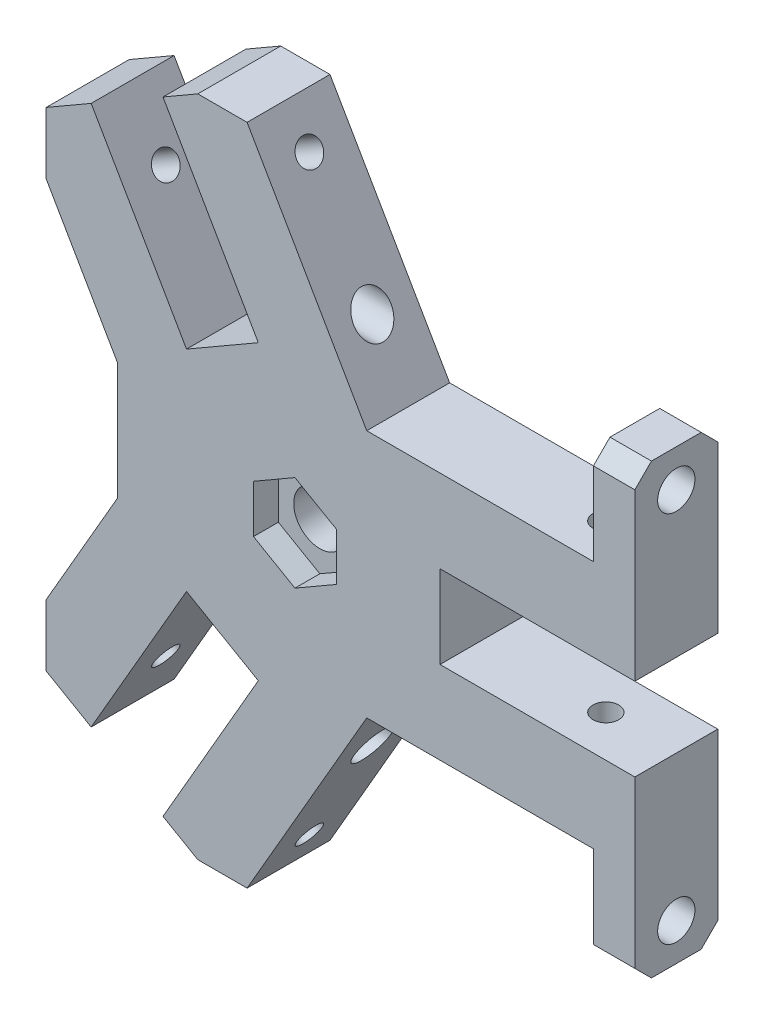
from build123d import *

# Parameters (mm, degrees)
SKETCH1_W                = 71
SKETCH1_H                = 80
BOSS_EXTRUDE1_DEPTH      = 10
SKETCH3_W                = 10
SKETCH3_H                = 10
CUT_EXTRUDE1_DEPTH       = 10
SKETCH5_W                = 28.158683969
SKETCH5_H                = 10
CUT_EXTRUDE3_DEPTH       = 10
CIRPATTERN1_COUNT        = 3
M6_CLEARANCE_HOLE1_D     = 6.3
CUT_EXTRUDE6_DEPTH       = 3
SKETCH11_R               = 1.55
CUT_EXTRUDE7_DEPTH       = 108.429046352
CIRPATTERN2_COUNT        = 3
CUT_EXTRUDE8_DEPTH       = 10
CUT_EXTRUDE9_DEPTH       = 10
CUT_EXTRUDE10_DEPTH      = 10
SKETCH15_W               = 111
SKETCH15_H               = 42
BOSS_EXTRUDE2_DEPTH      = 10
SKETCH22_W               = 15
SKETCH22_H               = 54
BOSS_EXTRUDE3_DEPTH      = 10
M4_CLEARANCE_HOLE1_D     = 4.5
M4_CLEARANCE_HOLE1_DEPTH = 30
M4_CLEARANCE_HOLE1_TIP   = 1.351936393
SKETCH26_W               = 47.7
SKETCH26_H               = 6
CUT_EXTRUDE13_DEPTH      = 10
CHAMFER1_SIZE            = 4
CHAMFER1_SIZE_2          = 6.92820323
SKETCH27_W               = 6.3
SKETCH27_H               = 6
CUT_EXTRUDE14_DEPTH      = 10
CHAMFER2_SIZE            = 6.92820323
CHAMFER2_SIZE_2          = 4
CUT_EXTRUDE15_DEPTH      = 10
CUT_EXTRUDE16_DEPTH      = 2.2
CUT_EXTRUDE17_DEPTH      = 10
M4_CLEARANCE_HOLE2_D     = 4.5
SKETCH33_W               = 30
SKETCH33_H               = 90
CUT_EXTRUDE18_DEPTH      = 138.189649755
SKETCH34_W               = 10
SKETCH34_H               = 22
BOSS_EXTRUDE4_DEPTH      = 5
SKETCH38_R               = 2.25
CUT_EXTRUDE20_DEPTH      = 41
CHAMFER3_SIZE            = 2


with BuildPart() as part:
    # Sketch1 → Boss-Extrude1 (new body)
    with BuildSketch(Plane.XY):
        with Locations((35.5, 40)):
            Rectangle(SKETCH1_W, SKETCH1_H)
    extrude(amount=BOSS_EXTRUDE1_DEPTH)

    # Sketch3 → Cut-Extrude1 (cut)
    with BuildSketch(Plane.XY.offset(10)):
        Polygon((25.580127019, 57.655444566), (16.919872981, 52.655444566), (11.919872981, 61.315698604), (20.580127019, 66.315698604), align=None)
        Polygon((11.919872981, 18.684301396), (20.580127019, 13.684301396), (25.580127019, 22.344555434), (16.919872981, 27.344555434), align=None)
        with Locations((52.5, 40)):
            Rectangle(SKETCH3_W, SKETCH3_H)
    extrude(amount=-CUT_EXTRUDE1_DEPTH, mode=Mode.SUBTRACT)

    # Sketch5 → Cut-Extrude3 (cut)
    with BuildSketch(Plane.XY.offset(10)):
        with Locations((71.579341985, 40)):
            Rectangle(SKETCH5_W, SKETCH5_H)
    cut_extrude3 = extrude(amount=-CUT_EXTRUDE3_DEPTH, mode=Mode.SUBTRACT)

    # CirPattern1: Cut-Extrude3 ×3 about axis
    cirpattern1_axis = Axis((30, 40, 10), (0, 0, -1))
    for i in range(1, CIRPATTERN1_COUNT):
        add(cut_extrude3.rotate(cirpattern1_axis, i * 360 / CIRPATTERN1_COUNT), mode=Mode.SUBTRACT)

    # M6 Clearance Hole1 (through all)
    with Locations(Plane.XY.offset(10)):
        with Locations((30, 40)):
            Hole(M6_CLEARANCE_HOLE1_D / 2)

    # Sketch10 → Cut-Extrude6 (cut)
    with BuildSketch(Plane.XY.offset(10)):
        Polygon((30, 45.773502692), (25, 42.886751346), (25, 37.113248654), (30, 34.226497308), (35, 37.113248654), (35, 42.886751346), align=None)
    extrude(amount=-CUT_EXTRUDE6_DEPTH, mode=Mode.SUBTRACT)

    # Sketch11 → Cut-Extrude7 (cut, through all)
    with BuildSketch(Plane.XZ):
        with Locations(Location((62.5, 5, 0), (0, 0, 270))):
            Circle(SKETCH11_R)
    cut_extrude7 = extrude(amount=-CUT_EXTRUDE7_DEPTH, mode=Mode.SUBTRACT)

    # CirPattern2: Cut-Extrude7 ×3 about axis
    cirpattern2_axis = Axis((30, 40, 7), (0, 0, 1))
    for i in range(1, CIRPATTERN2_COUNT):
        add(cut_extrude7.rotate(cirpattern2_axis, i * 360 / CIRPATTERN2_COUNT), mode=Mode.SUBTRACT)

    # Sketch12 → Cut-Extrude8 (cut)
    with BuildSketch(Plane.XY.offset(10)):
        Polygon((71, 0), (71, 25), (38.660254038, 25), (24.226497308, 0), align=None)
    cut_extrude8 = extrude(amount=-CUT_EXTRUDE8_DEPTH, mode=Mode.SUBTRACT)

    # Mirror1: Cut-Extrude8 across plane
    add(cut_extrude8.mirror(Plane(origin=(0, 40, 0), x_dir=(0, 0, 1), z_dir=(0, -1, 0))), mode=Mode.SUBTRACT)

    # Sketch13 → Cut-Extrude9 (cut)
    with BuildSketch(Plane.XY.offset(10)):
        Polygon((0, 61.961524227), (8.624364028, 47.023687548), (8.624364028, 32.976312452), (0, 18.038475773), align=None)
    extrude(amount=-CUT_EXTRUDE9_DEPTH, mode=Mode.SUBTRACT)

    # Sketch14 → Cut-Extrude10 (cut)
    with BuildSketch(Plane.XY.offset(10)):
        Polygon((-3.240381057, 12.425971147), (22.740381057, -2.574028853), (18.169872981, -10.490381057), (-7.810889132, 4.509618943), align=None)
    cut_extrude10 = extrude(amount=-CUT_EXTRUDE10_DEPTH, mode=Mode.SUBTRACT)

    # Mirror2: Cut-Extrude10 across plane
    add(cut_extrude10.mirror(Plane(origin=(0, 40, 0), x_dir=(0, 0, 1), z_dir=(0, -1, 0))), mode=Mode.SUBTRACT)

    # Sketch15 → Boss-Extrude2 (add)
    with BuildSketch(Plane.XY.offset(10)):
        with Locations((126.5, 40)):
            Rectangle(SKETCH15_W, SKETCH15_H)
    extrude(amount=-BOSS_EXTRUDE2_DEPTH)

    # Sketch22 → Boss-Extrude3 (add)
    with BuildSketch(Plane.XY.offset(10)):
        with Locations((174.5, 40)):
            Rectangle(SKETCH22_W, SKETCH22_H)
    extrude(amount=-BOSS_EXTRUDE3_DEPTH)

    # M4 Clearance Hole1
    with Locations(Plane(origin=(182, 0, 0), x_dir=(0, 0, -1), z_dir=(1, 0, 0))):
        with Locations((-5, 62.5), (-5, 17.5)):
            Hole(M4_CLEARANCE_HOLE1_D / 2, depth=M4_CLEARANCE_HOLE1_DEPTH)
            with Locations((0, 0, -(M4_CLEARANCE_HOLE1_DEPTH + M4_CLEARANCE_HOLE1_TIP / 2))):  # 118° drill point
                Cone(0, M4_CLEARANCE_HOLE1_D / 2, M4_CLEARANCE_HOLE1_TIP, mode=Mode.SUBTRACT)

    # Sketch26 → Cut-Extrude13 (cut)
    with BuildSketch(Plane.XY.offset(10)):
        with Locations((143.15, 58)):
            Rectangle(SKETCH26_W, SKETCH26_H)
    cut_extrude13 = extrude(amount=-CUT_EXTRUDE13_DEPTH, mode=Mode.SUBTRACT)

    # Mirror3: Cut-Extrude13 across plane
    add(cut_extrude13.mirror(Plane(origin=(0, 40, 0), x_dir=(0, 0, 1), z_dir=(0, -1, 0))), mode=Mode.SUBTRACT)

    # Chamfer1
    # the kernel refuses this chamfer: 6.92820323, 4 mm, written as the material it adds along each edge
    with BuildSketch(Plane(origin=(119.3, 25, 10), x_dir=(0.9983227437537926, 0.05789386240267157, 0), z_dir=(0, 0, -1))) as chamfer1_piece_1_section:
        Polygon((CHAMFER1_SIZE * 0.998322743754, CHAMFER1_SIZE * 0.0578938624027), (-CHAMFER1_SIZE_2 * 0.057893862405, CHAMFER1_SIZE_2 * 0.998322743793), (0, 0), align=None)
    chamfer1_piece_1 = extrude(amount=10, mode=Mode.PRIVATE)
    chamfer1_piece_1 = split(chamfer1_piece_1, bisect_by=Plane(origin=(120.625811149, 19, 5), z_dir=(0, 1, 0)), keep=Keep.TOP, mode=Mode.PRIVATE)
    add(chamfer1_piece_1)
    with BuildSketch(Plane(origin=(119.3, 55, 10), x_dir=(-0.019326765612697788, 0.999813220622208, 0), z_dir=(0, 0, -1))) as chamfer1_piece_2_section:
        Polygon((CHAMFER1_SIZE_2 * 0.999813220662, CHAMFER1_SIZE_2 * 0.0193267656135), (-CHAMFER1_SIZE * 0.0193267656127, CHAMFER1_SIZE * 0.999813220622), (0, 0), align=None)
    chamfer1_piece_2 = extrude(amount=10, mode=Mode.PRIVATE)
    chamfer1_piece_2 = split(chamfer1_piece_2, bisect_by=Plane(origin=(120.625811149, 61, 5), z_dir=(0, -1, 0)), keep=Keep.TOP, mode=Mode.PRIVATE)
    add(chamfer1_piece_2)

    # Sketch27 → Cut-Extrude14 (cut)
    with BuildSketch(Plane.XY.offset(10)):
        with Locations((74.15, 58)):
            Rectangle(SKETCH27_W, SKETCH27_H)
    cut_extrude14 = extrude(amount=-CUT_EXTRUDE14_DEPTH, mode=Mode.SUBTRACT)

    # Mirror4: Cut-Extrude14 across plane
    add(cut_extrude14.mirror(Plane(origin=(0, 40, 0), x_dir=(0, 0, 1), z_dir=(0, -1, 0))), mode=Mode.SUBTRACT)

    # Chamfer2
    # the kernel refuses this chamfer: 6.92820323, 4 mm, written as the material it adds along each edge
    with BuildSketch(Plane(origin=(77.3, 55, 10), x_dir=(0.019326765612699692, 0.9998132206222079, 0), z_dir=(0, 0, -1))) as chamfer2_piece_1_section:
        Polygon((CHAMFER2_SIZE * 0.999813220662, -CHAMFER2_SIZE * 0.0193267656135), (-CHAMFER2_SIZE_2 * 0.0193267656127, -CHAMFER2_SIZE_2 * 0.999813220622), (0, 0), align=None)
    chamfer2_piece_1 = extrude(amount=10, mode=Mode.PRIVATE)
    chamfer2_piece_1 = split(chamfer2_piece_1, bisect_by=Plane(origin=(75.974188851, 61, 5), z_dir=(0, -1, 0)), keep=Keep.TOP, mode=Mode.PRIVATE)
    add(chamfer2_piece_1)
    with BuildSketch(Plane(origin=(77.3, 25, 10), x_dir=(-0.9983227437537929, 0.05789386240266474, 0), z_dir=(0, 0, -1))) as chamfer2_piece_2_section:
        Polygon((CHAMFER2_SIZE_2 * 0.998322743754, -CHAMFER2_SIZE_2 * 0.0578938624027), (-CHAMFER2_SIZE * 0.057893862405, -CHAMFER2_SIZE * 0.998322743793), (0, 0), align=None)
    chamfer2_piece_2 = extrude(amount=10, mode=Mode.PRIVATE)
    chamfer2_piece_2 = split(chamfer2_piece_2, bisect_by=Plane(origin=(75.974188851, 19, 5), z_dir=(0, 1, 0)), keep=Keep.TOP, mode=Mode.PRIVATE)
    add(chamfer2_piece_2)

    # Sketch21 → Cut-Extrude15 (cut)
    with BuildSketch(Plane.XY.offset(10)):
        with BuildLine():
            Line((97.55, 47.5), (99.05, 47.5))
            ThreePointArc((99.05, 47.5), (106.55, 40), (99.05, 32.5))
            Line((99.05, 32.5), (97.55, 32.5))
            ThreePointArc((97.55, 32.5), (90.05, 40), (97.55, 47.5))
        make_face()
    extrude(amount=-CUT_EXTRUDE15_DEPTH, mode=Mode.SUBTRACT)

    # Sketch28 → Cut-Extrude16 (cut)
    with BuildSketch(Plane.XY.offset(10)):
        with BuildLine():
            Line((97.55, 51.25), (99.05, 51.25))
            ThreePointArc((99.05, 51.25), (110.3, 40), (99.05, 28.75))
            Line((99.05, 28.75), (97.55, 28.75))
            ThreePointArc((97.55, 28.75), (86.3, 40), (97.55, 51.25))
        make_face()
    extrude(amount=-CUT_EXTRUDE16_DEPTH, mode=Mode.SUBTRACT)

    # Sketch29 → Cut-Extrude17 (cut)
    with BuildSketch(Plane.XY.offset(10)):
        with BuildLine():
            Line((82.05, 57.2), (83.55, 57.2))
            ThreePointArc((83.55, 57.2), (85.25, 55.5), (83.55, 53.8))
            Line((83.55, 53.8), (82.05, 53.8))
            ThreePointArc((82.05, 53.8), (80.35, 55.5), (82.05, 57.2))
        make_face()
        with BuildLine():
            Line((113.05, 53.8), (114.55, 53.8))
            ThreePointArc((114.55, 53.8), (116.25, 55.5), (114.55, 57.2))
            Line((114.55, 57.2), (113.05, 57.2))
            ThreePointArc((113.05, 57.2), (111.35, 55.5), (113.05, 53.8))
        make_face()
        with BuildLine():
            Line((113.05, 22.8), (114.55, 22.8))
            ThreePointArc((114.55, 22.8), (116.25, 24.5), (114.55, 26.2))
            Line((114.55, 26.2), (113.05, 26.2))
            ThreePointArc((113.05, 26.2), (111.35, 24.5), (113.05, 22.8))
        make_face()
        with BuildLine():
            Line((82.05, 22.8), (83.55, 22.8))
            ThreePointArc((83.55, 22.8), (85.25, 24.5), (83.55, 26.2))
            Line((83.55, 26.2), (82.05, 26.2))
            ThreePointArc((82.05, 26.2), (80.35, 24.5), (82.05, 22.8))
        make_face()
    extrude(amount=-CUT_EXTRUDE17_DEPTH, mode=Mode.SUBTRACT)

    # M4 Clearance Hole2 (through all)
    with Locations(Plane.XY.offset(10)):
        with Locations((134, 50.5), (155, 50.5), (155, 29.5), (134, 29.5)):
            Hole(M4_CLEARANCE_HOLE2_D / 2)

    # Sketch33 → Cut-Extrude18 (cut, through all)
    with BuildSketch(Plane.ZY.offset(-71)):
        with Locations((5, 40)):
            Rectangle(SKETCH33_W, SKETCH33_H)
    extrude(amount=-CUT_EXTRUDE18_DEPTH, mode=Mode.SUBTRACT)

    # Sketch34 → Boss-Extrude4 (add)
    with BuildSketch(Plane(origin=(71, 0, 0), x_dir=(0, 0, -1), z_dir=(1, 0, 0))):
        with Locations((-5, 56)):
            Rectangle(SKETCH34_W, SKETCH34_H)
    boss_extrude4 = extrude(amount=-BOSS_EXTRUDE4_DEPTH)

    # Mirror5: Boss-Extrude4 across plane
    add(boss_extrude4.mirror(Plane(origin=(0, 40, 0), x_dir=(0, 0, 1), z_dir=(0, -1, 0))))

    # Sketch38 → Cut-Extrude20 (cut)
    with BuildSketch(Plane(origin=(71, 0, 0), x_dir=(0, 0, -1), z_dir=(1, 0, 0))):
        with Locations((-5, 62.5)):
            Circle(SKETCH38_R)
        with Locations((-5, 17.5)):
            Circle(SKETCH38_R)
    extrude(amount=-CUT_EXTRUDE20_DEPTH, mode=Mode.SUBTRACT)

    # Chamfer3
    chamfer3_edges = [part.edges().sort_by_distance(p)[0] for p in [
        (68.5, 67, 10),
        (68.5, 67, 0),
        (68.5, 13, 10),
        (68.5, 13, 0),
    ]]
    chamfer(chamfer3_edges, length=CHAMFER3_SIZE)


solid = part.part
